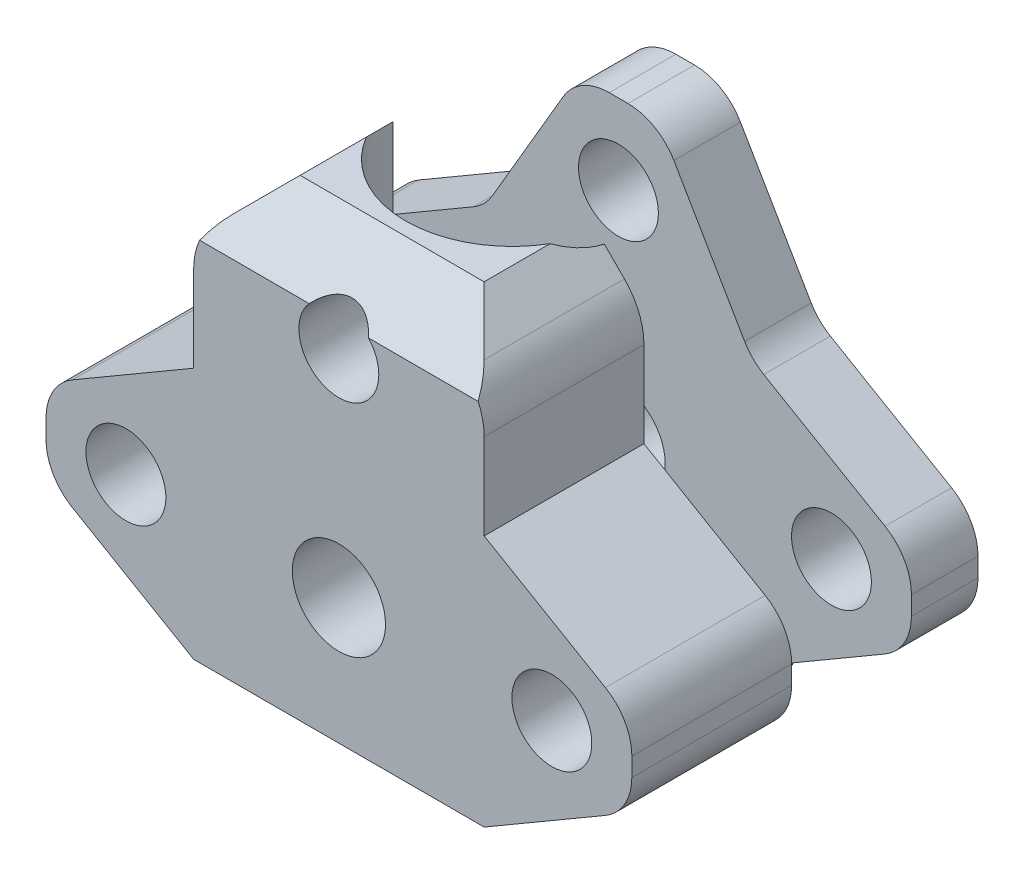
from build123d import *
from OCP.BRepAlgoAPI import BRepAlgoAPI_Cut
from OCP.TopTools import TopTools_ListOfShape
from OCP.BRepFilletAPI import BRepFilletAPI_MakeChamfer

# Parameters (mm, degrees)
BOSS_EXTRUDE1_DEPTH = 2.5
CUT_EXTRUDE1_DEPTH  = 2.5
SKETCH3_R           = 1.75
CUT_EXTRUDE2_DEPTH  = 2.5
FILLET1_R           = 2
SKETCH4_R           = 1.5000000000000004
SKETCH4_R_2         = 1.5000000000000013
SKETCH4_R_3         = 1.75
BOSS_EXTRUDE2_DEPTH = 13
CUT_EXTRUDE3_DEPTH  = 10
BOSS_EXTRUDE3_REACH = 25.186
CHAMFER1_SIZE       = 2
CHAMFER2_SIZE       = 2
CHAMFER2_SIZE2      = 2.0025685654709307
CHAMFER2_SIZE2_2    = 1.9974412928420675
FILLET3_R           = 2.5
CUT_EXTRUDE4_START  = -10.500000000000002
CUT_EXTRUDE4_DEPTH  = 10.500000000000002


with BuildPart() as part:
    # Sketch1 → Boss-Extrude1 (new body)
    with BuildSketch(Plane.XY):
        with BuildLine():
            Line((-4.999999999999999, 6.24499799839824), (-4.999999999999999, 7.5000000000000195))
            Line((-5, 7.5000000000000195), (-10.998080575377891, 1.5019194246221268))
            Line((-10.998080575377891, 1.501919424622125), (-11.00195105101394, -1.498048948986069))
            Line((-11.001951051013936, -1.4980489489860662), (-4.999999999999998, -7.500000000000005))
            Line((-4.999999999999997, -7.500000000000005), (-4.999999999999997, -6.244997998398235))
            ThreePointArc((-5.00000000000014, -6.2449979983982855), (-6.854583671255731, -4.124885779479755), (-7.859375000000005, -1.4933936551944083))
            ThreePointArc((-7.859375000000005, -1.4933936551944376), (-9.5, 1.8e-16), (-7.859375000000005, 1.4933936551944376))
            ThreePointArc((-7.859375000000005, 1.49339365519441), (-6.854583671255727, 4.124885779479761), (-5.000000000000136, 6.244997998398289))
        make_face()
        with BuildLine():
            Line((1.68e-15, 9.499997383969479), (1.22e-15, 11.000018309985846))
            Line((3.55e-15, 11.000018309985846), (-1.4980489489860744, 11.00195105101394))
            Line((-1.4980489489860798, 11.00195105101394), (-5, 7.5000000000000195))
            Line((-4.999999999999999, 7.5000000000000195), (-4.999999999999999, 6.24499799839824))
            ThreePointArc((-5.000000000000136, 6.244997998398289), (-3.346805660983304, 7.266284598583385), (-1.4961457172971084, 7.858851569575132))
            ThreePointArc((-1.4961457172971453, 7.8588515695751315), (-1.111300148118322, 9.01055955860306), (4.818e-14, 9.499997383969479))
        make_face()
        with BuildLine():
            Line((1.5019194246221144, 10.998080575377891), (3.55e-15, 11.000018309985846))
            Line((1.22e-15, 11.000018309985846), (1.68e-15, 9.499997383969479))
            ThreePointArc((4.818e-14, 9.499997383969479), (1.0588487262158253, 9.059669249106534), (1.4971985566693762, 8.000000000000005))
            ThreePointArc((1.4971985566693762, 8.000000000000005), (1.4955583505456835, 7.929872059099467), (1.4906413192094436, 7.8598974839030715))
            ThreePointArc((1.4906413192093328, 7.859897483903073), (3.3442609453700096, 7.2674561387925065), (4.9999999999998535, 6.2449979983985155))
            Line((5.000000000000001, 6.244997998398569), (5.000000000000001, 7.5))
            Line((5, 7.500000000000001), (1.5019194246221128, 10.998080575377887))
        make_face()
        with BuildLine():
            Line((11.001951051013934, 1.4980489489860673), (5, 7.500000000000001))
            Line((5.000000000000001, 7.5), (5.000000000000001, 6.244997998398569))
            ThreePointArc((4.9999999999998535, 6.2449979983985155), (6.853793728502059, 4.126198192906619), (7.858802525285774, 1.4964033107962378))
            ThreePointArc((7.858802525285775, 1.4964033107964132), (9.007744437103462, 1.111312617626003), (9.497198556669378, 0.00280144333063154))
            ThreePointArc((9.497198556669378, 0.00280144333063118), (9.008132689961226, -1.1053556656324712), (7.859848985808763, -1.4908970186704535))
            ThreePointArc((7.859848985808765, -1.4908970186706159), (6.855238727849902, -4.123797034795342), (4.99999999999985, -6.244997998398518))
            Line((5.000000000000003, -6.244997998398572), (5.000000000000003, -7.4999999999999805))
            Line((5.000000000000002, -7.49999999999998), (10.998080575377884, -1.5019194246220966))
            Line((10.998080575377887, -1.5019194246220966), (11.001951051013936, 1.498048948986062))
        make_face()
        with BuildLine():
            ThreePointArc((-1.493650300889642, -7.859326229305683), (-3.3456520241707244, -7.266815845551774), (-5.00000000000014, -6.2449979983982855))
            Line((-4.999999999999997, -6.244997998398235), (-4.999999999999997, -7.500000000000005))
            Line((-4.999999999999998, -7.500000000000005), (-1.501919424622118, -10.998080575377886))
            Line((-1.5019194246221126, -10.998080575377887), (8.88e-15, -11.000018309985842))
            Line((8.01e-15, -11.000018309985842), (7.55e-15, -9.497198556669376))
            ThreePointArc((5.28e-15, -9.497198556669375), (-1.10833399547373, -9.007938757946256), (-1.4936503008895057, -7.859326229305681))
        make_face()
        with BuildLine():
            Line((5.000000000000003, -7.4999999999999805), (5.000000000000003, -6.244997998398572))
            ThreePointArc((4.99999999999985, -6.244997998398518), (3.345652024170554, -7.266815845551852), (1.4936503008896462, -7.859326229305682))
            ThreePointArc((1.4936503008895117, -7.859326229305681), (1.4984117343597991, -7.928189322991056), (1.5000000000000033, -7.997198556669375))
            ThreePointArc((1.5000000000000033, -7.997198556669375), (1.0606601717798252, -9.057858728449196), (5.28e-15, -9.497198556669375))
            Line((7.55e-15, -9.497198556669376), (8.01e-15, -11.000018309985842))
            Line((8.88e-15, -11.000018309985842), (1.4980489489860478, -11.001951051013936))
            Line((1.498048948986046, -11.001951051013936), (5.000000000000002, -7.49999999999998))
        make_face()
        with BuildLine():
            ThreePointArc((4.948e-14, 6.500002616030531), (-1.0112889752948502, 6.88961587823281), (-1.4961457172971453, 7.8588515695751315))
            ThreePointArc((-1.4961457172971084, 7.858851569575132), (-3.346805660983304, 7.266284598583385), (-5.000000000000136, 6.244997998398289))
            Line((-4.999999999999999, 6.24499799839824), (-4.999999999999997, -6.244997998398235))
            ThreePointArc((-5.00000000000014, -6.2449979983982855), (-3.3456520241707244, -7.266815845551774), (-1.493650300889642, -7.859326229305683))
            ThreePointArc((-1.4936503008895057, -7.859326229305681), (-1.0107402012768776, -6.88886456119564), (4.65e-15, -6.497198556669375))
            Line((6.62e-15, -6.497198556669376), (2.61e-15, 6.500002616030532))
        make_face()
        with BuildLine():
            Line((-4.999999999999997, -6.244997998398235), (-4.999999999999999, 6.24499799839824))
            ThreePointArc((-5.000000000000136, 6.244997998398289), (-6.854583671255727, 4.124885779479761), (-7.859375000000005, 1.49339365519441))
            ThreePointArc((-7.859375000000005, 1.4933936551944376), (-6.890735040668823, 1.0097184013377218), (-6.5, 0))
            ThreePointArc((-6.5, -3.7e-16), (-6.890735040668824, -1.0097184013377225), (-7.859375000000005, -1.4933936551944376))
            ThreePointArc((-7.859375000000005, -1.4933936551944083), (-6.854583671255731, -4.124885779479755), (-5.00000000000014, -6.2449979983982855))
        make_face()
        with BuildLine():
            Line((5.000000000000003, -6.244997998398572), (5.000000000000001, 6.244997998398569))
            ThreePointArc((4.9999999999998535, 6.2449979983985155), (3.3442609453700096, 7.2674561387925065), (1.4906413192093328, 7.859897483903073))
            ThreePointArc((1.4906413192094436, 7.8598974839030715), (1.0081462278259794, 6.891855241323125), (4.948e-14, 6.500002616030531))
            Line((2.61e-15, 6.500002616030532), (6.62e-15, -6.497198556669376))
            ThreePointArc((4.65e-15, -6.497198556669375), (1.010740201276885, -6.888864561195641), (1.4936503008895117, -7.859326229305681))
            ThreePointArc((1.4936503008896462, -7.859326229305682), (3.345652024170554, -7.266815845551852), (4.99999999999985, -6.244997998398518))
        make_face()
        with BuildLine():
            ThreePointArc((7.858802525285774, 1.4964033107962378), (6.853793728502059, 4.126198192906619), (4.9999999999998535, 6.2449979983985155))
            Line((5.000000000000001, 6.244997998398569), (5.000000000000003, -6.244997998398572))
            ThreePointArc((4.99999999999985, -6.244997998398518), (6.855238727849902, -4.123797034795342), (7.859848985808765, -1.4908970186706159))
            ThreePointArc((7.859848985808763, -1.4908970186704535), (6.497198648703558, 0.0022759887344901), (7.858802525285775, 1.4964033107964132))
        make_face()
    extrude(amount=BOSS_EXTRUDE1_DEPTH)

    # Sketch2 → Cut-Extrude1 (cut)
    with BuildSketch(Plane.XY.offset(2.5)):
        Polygon((-4.999999999999992, 4.999999999999999), (-10.998080575377891, 1.5019194246221257), (-1.4980489489860764, 11.001951051013943), align=None)
        Polygon((-4.999999999999992, -5.000000000000001), (-1.5019194246221135, -10.998080575377887), (-11.001951051013943, -1.498048948986061), align=None)
        Polygon((1.5019194246221084, 10.998080575377891), (4.999999999999994, 4.999999999999999), (11.00195105101394, 1.4980489489860627), align=None)
        Polygon((10.99808057537789, -1.5019194246220935), (4.9999999999999805, -4.999999999999987), (1.4980489489860442, -11.00195105101394), align=None)
    extrude(amount=-CUT_EXTRUDE1_DEPTH, mode=Mode.SUBTRACT)

    # Sketch3 → Cut-Extrude2 (cut)
    with BuildSketch(Plane.XY.offset(2.5)):
        Circle(SKETCH3_R)
    extrude(amount=-CUT_EXTRUDE2_DEPTH, mode=Mode.SUBTRACT)

    # Fillet1
    fillet1_edges = [part.edges().sort_by_distance(p)[0] for p in [
        (1.498048948986047, -11.001951051013936, 1.25),
        (-1.5019194246221153, -10.998080575377887, 1.25),
        (-11.001951051013938, -1.4980489489860678, 1.25),
        (-10.998080575377891, 1.501919424622126, 1.25),
        (-1.498048948986077, 11.00195105101394, 1.25),
        (1.5019194246221135, 10.99808057537789, 1.25),
        (11.001951051013936, 1.4980489489860647, 1.25),
        (10.998080575377886, -1.5019194246220966, 1.25),
        (-4.999999999999992, -5.000000000000001, 1.25),
        (4.999999999999994, 4.999999999999999, 1.25),
        (4.9999999999999805, -4.999999999999987, 1.25),
        (-4.999999999999992, 4.999999999999999, 1.25),
    ]]
    fillet(fillet1_edges, radius=FILLET1_R)


with BuildPart() as body_2:
    # Sketch4 → Boss-Extrude2 (new body)
    with BuildSketch(Plane.XY):
        with BuildLine():
            Line((10.999560605079953, -0.35476266258465405), (11.000466938049293, 0.3477272894640323))
            ThreePointArc((11.000466938049293, 0.3477272894640323), (10.735445401790967, 1.3452224552196366), (10.008385221504662, 2.077763590329856))
            Line((10.008385221504662, 2.077763590329856), (5.454592230537567, 4.7347596263310265))
            Line((5.454592230537567, 4.7347596263310265), (-5.454645413114042, 4.734850796298495))
            Line((-5.454645413114042, 4.734850796298495), (-10.007132441559365, 2.0798403735915616))
            ThreePointArc((-10.007132441559365, 2.0798403735915616), (-10.733154020560564, 1.3495085664980957), (-10.999560605079957, 0.35476266258468264))
            Line((-10.999560605079957, 0.35476266258468264), (-11.000466938049296, -0.3477272894640293))
            ThreePointArc((-11.000466938049296, -0.3477272894640293), (-10.735445401790972, -1.3452224552196315), (-10.00838522150467, -2.0777635903298513))
            Line((-10.00838522150467, -2.0777635903298513), (-5.4545922305375685, -4.734759626331021))
            Line((-5.4545922305375685, -4.734759626331021), (5.454645413114027, -4.734850796298485))
            Line((5.454645413114027, -4.734850796298485), (10.007132441559367, -2.0798403735915305))
            ThreePointArc((10.007132441559367, -2.0798403735915305), (10.733154020560562, -1.3495085664980646), (10.999560605079953, -0.35476266258465405))
        make_face()
        with Locations(Location((-8, 0, 0), (0, 0, 180))):
            Circle(SKETCH4_R, mode=Mode.SUBTRACT)
        with Locations(Location((7.997198556669378, 0.00280144333063154, 0), (0, 0, 180))):
            Circle(SKETCH4_R_2, mode=Mode.SUBTRACT)
        with Locations(Location((0, 0, 0), (0, 0, 180))):
            Circle(SKETCH4_R_3, mode=Mode.SUBTRACT)
    extrude(amount=BOSS_EXTRUDE2_DEPTH)


with BuildPart() as cut_extrude3_tool:
    # Sketch5 → Cut-Extrude3 (new body)
    with BuildSketch(Plane(origin=(-3.956940449073e-05, -4.7348052107618415, 0), x_dir=(0.9999999999650793, -8.35713460807451e-06, 0), z_dir=(-8.35713460807451e-06, -0.9999999999650793, 0))):
        with BuildLine():
            ThreePointArc((3.968176735513784, 6.999999999999911), (-0.00045023108312392, 10.5), (-3.969077197680013, 6.99999999999989))
            Line((-3.9690771976800265, 7.000000000000001), (3.9681767355137936, 7.000000000000001))
        make_face()
        with BuildLine():
            Line((-5.4545526613235555, 6.000000000000002), (-5.4545526613235555, 0))
            Line((-5.4545526613235555, 0), (5.454684982708999, 0))
            Line((5.454684982709, 0), (5.454684982709, 6.000000000000002))
            Line((5.454684982709001, 6.000000000000002), (3.9681767355137936, 6.000000000000002))
            ThreePointArc((3.968176735513784, 6.000000000000091), (-0.0004502310831249, 2.5), (-3.9690771976800137, 6.000000000000113))
            Line((-3.9690771976800274, 6.000000000000002), (-5.4545526613235555, 6.000000000000002))
        make_face()
        Polygon((-10.00836785700516, 0), (-5.4545526613235555, 0), (-5.4545526613235555, 6.000000000000002), (-11.000464031661387, 6.000000000000002), (-11.000464031661387, 0), align=None)
        Polygon((5.454684982709, 6.000000000000002), (5.454684982709, 0), (10.007149822715876, 0), (10.999563569495164, 0), (10.999563569495164, 6.000000000000002), align=None)
        Polygon((5.454684982709, 7.000000000000001), (5.454684982709, 6.499999999999999), (10.999563569495166, 6.499999999999998), (10.999563569495164, 7.000000000000001), align=None)
        Polygon((5.454684982709, 6.499999999999999), (5.454684982709, 6.000000000000002), (10.999563569495166, 6.000000000000002), (10.999563569495164, 6.499999999999998), align=None)
        with BuildLine():
            Line((3.9995497689168857, 6.499999999999999), (5.454684982709001, 6.499999999999999))
            Line((5.454684982709, 6.499999999999999), (5.454684982709, 7.000000000000001))
            Line((5.454684982709001, 7.000000000000001), (3.9681767355137936, 7.000000000000001))
            ThreePointArc((3.968176735513784, 6.999999999999911), (3.9916988058635026, 6.750491650172627), (3.9995497689168866, 6.5))
        make_face()
        with BuildLine():
            Line((3.9681767355137936, 6.000000000000002), (5.454684982709001, 6.000000000000002))
            Line((5.454684982709, 6.000000000000002), (5.454684982709, 6.499999999999999))
            Line((5.454684982709001, 6.499999999999999), (3.9995497689168857, 6.499999999999999))
            ThreePointArc((3.9995497689168866, 6.499999999999999), (3.9916988058635026, 6.249508349827371), (3.968176735513784, 6.000000000000091))
        make_face()
        with BuildLine():
            ThreePointArc((-3.969077197680013, 6.99999999999989), (-3.99259926802973, 6.750491650172617), (-4.000450231083113, 6.500000000000001))
            Line((-4.000450231083113, 6.500000000000001), (3.9995497689168857, 6.499999999999999))
            ThreePointArc((3.9995497689168866, 6.5), (3.9916988058635026, 6.750491650172627), (3.968176735513784, 6.999999999999911))
            Line((3.9681767355137936, 7.000000000000001), (-3.9690771976800265, 7.000000000000001))
        make_face()
        with BuildLine():
            ThreePointArc((-4.000450231083113, 6.500000000000001), (-3.99259926802973, 6.249508349827385), (-3.9690771976800137, 6.000000000000113))
            Line((-3.9690771976800274, 6.000000000000002), (3.9681767355137936, 6.000000000000002))
            ThreePointArc((3.968176735513784, 6.000000000000091), (3.9916988058635026, 6.249508349827371), (3.9995497689168866, 6.499999999999999))
            Line((3.9995497689168857, 6.499999999999999), (-4.000450231083113, 6.500000000000001))
        make_face()
        with BuildLine():
            Line((-5.4545526613235555, 7.000000000000001), (-5.4545526613235555, 6.500000000000001))
            Line((-5.4545526613235555, 6.500000000000001), (-4.000450231083113, 6.500000000000001))
            ThreePointArc((-4.000450231083113, 6.500000000000001), (-3.99259926802973, 6.750491650172617), (-3.969077197680013, 6.99999999999989))
            Line((-3.9690771976800265, 7.000000000000001), (-5.4545526613235555, 7.000000000000001))
        make_face()
        with BuildLine():
            Line((-5.4545526613235555, 6.500000000000001), (-5.4545526613235555, 6.000000000000002))
            Line((-5.4545526613235555, 6.000000000000002), (-3.9690771976800274, 6.000000000000002))
            ThreePointArc((-3.9690771976800137, 6.000000000000113), (-3.99259926802973, 6.249508349827385), (-4.000450231083113, 6.500000000000001))
            Line((-4.000450231083113, 6.500000000000001), (-5.4545526613235555, 6.500000000000001))
        make_face()
        Polygon((-11.000464031661387, 6.000000000000002), (-5.4545526613235555, 6.000000000000002), (-5.4545526613235555, 6.500000000000001), (-11.000464031661387, 6.500000000000002), align=None)
        Polygon((-11.000464031661387, 6.500000000000002), (-5.4545526613235555, 6.500000000000001), (-5.4545526613235555, 7.000000000000001), (-11.000464031661387, 7.000000000000001), align=None)
        with BuildLine():
            Line((3.9681767355137936, 6.000000000000002), (-3.9690771976800274, 6.000000000000002))
            ThreePointArc((-3.9690771976800137, 6.000000000000113), (-0.0004502310831249, 2.5), (3.968176735513784, 6.000000000000091))
        make_face()
        Polygon((5.454684982708999, 0), (-5.4545526613235555, 0), (-10.00836785700516, 0), (-11.000464031661387, 0), (-11.000464031661387, -0.1540392839917084), (11.47537378277417, -0.15403928399170852), (11.475373782774168, 7.000000000000001), (11.000464031661384, 7.000000000000001), (11.000464031661384, 0), (10.999563569495164, 0), (10.007149822715876, 0), align=None)
        Polygon((10.999563569495164, 6.499999999999998), (10.999563569495164, 6.000000000000002), (10.999563569495164, 0), (11.000464031661384, 0), (11.000464031661384, 7.000000000000001), (10.999563569495166, 7.000000000000001), align=None)
    extrude(amount=-CUT_EXTRUDE3_DEPTH)


with BuildPart() as body_2_1:
    add(body_2.part)

    # Cut-Extrude3: cut by cut_extrude3_tool, with a tolerance
    cut_extrude3_stock = TopTools_ListOfShape()
    cut_extrude3_stock.Append(body_2_1.part.wrapped)
    cut_extrude3_tools = TopTools_ListOfShape()
    cut_extrude3_tools.Append(cut_extrude3_tool.part.wrapped)
    cut_extrude3_cut = BRepAlgoAPI_Cut()
    cut_extrude3_cut.SetArguments(cut_extrude3_stock)
    cut_extrude3_cut.SetTools(cut_extrude3_tools)
    cut_extrude3_cut.SetFuzzyValue(0.00001)
    cut_extrude3_cut.Build()
    add(Compound.cast(cut_extrude3_cut.Shape()).solids(), mode=Mode.REPLACE)

    # Boss-Extrude3: up to this plane
    boss_extrude3_end = Plane(origin=(0.0141918936116578, 11.002801443330645, 15.5), z_dir=(0.0012901710727390775, 0.9999991677289553, 0))
    # Sketch6 → Boss-Extrude3 (add, up to the surface)
    with BuildSketch(Plane(origin=(3.956940449337e-05, 4.734805210761849, 0), x_dir=(0.9999999999650793, -8.357134608631048e-06, 0), z_dir=(8.357134608631048e-06, 0.9999999999650793, 0)), mode=Mode.PRIVATE) as boss_extrude3_sk1:
        with BuildLine():
            Line((-3.969077197680004, -6.999999999999999), (-5.454684982709018, -7))
            Line((-5.454684982709018, -7), (-5.454684982709018, -13))
            Line((-5.454684982709018, -13), (5.454552661323551, -13))
            Line((5.454552661323551, -13), (5.454552661323551, -7))
            Line((5.454552661323551, -7), (3.968176735513771, -7.000000000000001))
            ThreePointArc((3.968176735513771, -7.000000000000001), (-0.00045023108311679, -10.500000000000002), (-3.969077197680004, -6.999999999999999))
        make_face()
    boss_extrude3_tool1 = split(extrude(boss_extrude3_sk1.sketch, amount=BOSS_EXTRUDE3_REACH, mode=Mode.PRIVATE), bisect_by=boss_extrude3_end, keep=Keep.BOTH, mode=Mode.PRIVATE)
    add(boss_extrude3_tool1.solids().sort_by_distance((0.000157, 4.734805, 10.729608))[0])

    # Chamfer1
    chamfer1_edges = [body_2_1.edges().sort_by_distance(p)[0] for p in [
        (2.579135274328e-05, 11.002819720041206, 13),
    ]]
    chamfer(chamfer1_edges, length=CHAMFER1_SIZE)

    # Chamfer2: one chamfer whose edges measure the first distance from different faces: ONE call of the kernel's chamfer builder (chamfer() names one face for all edges)
    chamfer2_edges_1 = [body_2_1.edges().sort_by_distance(p)[0] for p in [
        (5.4546445547470315, 10.995782322842832, 9),
    ]]
    chamfer2_side_1 = [body_2_1.faces().sort_by_distance(p)[0] for p in [
        (5.4546172347602715, 7.726720851550559, 9.868788931910801),
    ]]
    chamfer2_edges_2 = [body_2_1.edges().sort_by_distance(p)[0] for p in [
        (-5.454592972041547, 11.009857117239576, 9),
    ]]
    chamfer2_side_2 = [body_2_1.faces().sort_by_distance(p)[0] for p in [
        (-5.454620351012832, 7.733737661609113, 9.869097734900382),
    ]]
    chamfer2 = BRepFilletAPI_MakeChamfer(body_2_1.part.solid().wrapped)
    for e in chamfer2_edges_1:
        chamfer2.Add(CHAMFER2_SIZE, CHAMFER2_SIZE2, e.wrapped, chamfer2_side_1[0].wrapped)  # the first distance lies on this face
    for e in chamfer2_edges_2:
        chamfer2.Add(CHAMFER2_SIZE, CHAMFER2_SIZE2_2, e.wrapped, chamfer2_side_2[0].wrapped)  # the first distance lies on this face
    add(Compound.cast(chamfer2.Shape()), mode=Mode.REPLACE)

    # Fillet3
    fillet3_edges = [body_2_1.edges().sort_by_distance(p)[0] for p in [
        (5.454627840477814, 8.995782322912673, 9.99999917847617),
        (-5.454609686310764, 9.009857117309418, 9.999999178476168),
    ]]
    fillet(fillet3_edges, radius=FILLET3_R)

    # Sketch8 → Cut-Extrude4 (cut)
    with BuildSketch(Plane.XY.offset(13).offset(CUT_EXTRUDE4_START)):
        with BuildLine():
            ThreePointArc((1.4971985566693886, 8.000000000000023), (1.398126121533543, 8.536098832309692), (1.1139959459976678, 9.001380842232159))
            Line((1.1139959459976643, 9.001380842232146), (-1.1170112117076005, 9.004259225525686))
            ThreePointArc((-1.1170112117075874, 9.00425922552565), (-0.540707265679908, 6.5997652602928785), (1.4971985566693886, 8.000000000000023))
        make_face()
        with BuildLine():
            Line((-1.1170112117076005, 9.004259225525686), (1.1139959459976643, 9.001380842232146))
            ThreePointArc((1.1139959459976678, 9.001380842232159), (-0.00086618672153648, 9.499998751593457), (-1.1170112117075874, 9.00425922552565))
        make_face()
    extrude(amount=CUT_EXTRUDE4_DEPTH, mode=Mode.SUBTRACT)


solid = Compound([part.part, body_2_1.part])
